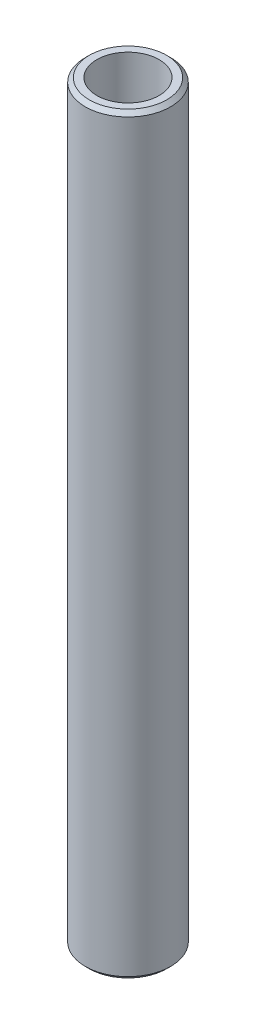
from build123d import *

# Parameters (mm, degrees)
SKETCH1_R           = 17.5
BOSS_EXTRUDE1_DEPTH = 308.629632006
SKETCH2_R           = 12.779506177
CUT_EXTRUDE1_DEPTH  = 310.62033162
CHAMFER1_SIZE       = 1.640858656


with BuildPart() as part:
    # Sketch1 → Boss-Extrude1 (new body)
    with BuildSketch(Plane(origin=(0, 0, 0), x_dir=(1, 0, 0), z_dir=(0, 1, 0))):
        Circle(SKETCH1_R)
    extrude(amount=BOSS_EXTRUDE1_DEPTH)

    # Sketch2 → Cut-Extrude1 (cut, through all)
    with BuildSketch(Plane(origin=(0, 0, 0), x_dir=(1, 0, 0), z_dir=(0, 1, 0))):
        Circle(SKETCH2_R)
    extrude(amount=CUT_EXTRUDE1_DEPTH, mode=Mode.SUBTRACT)

    # Chamfer1
    chamfer1_edges = [part.edges().sort_by_distance(p)[0] for p in [
        (-17.5, 308.629632006, 0),
        (-17.5, 0, 0),
    ]]
    chamfer(chamfer1_edges, length=CHAMFER1_SIZE)


solid = part.part
